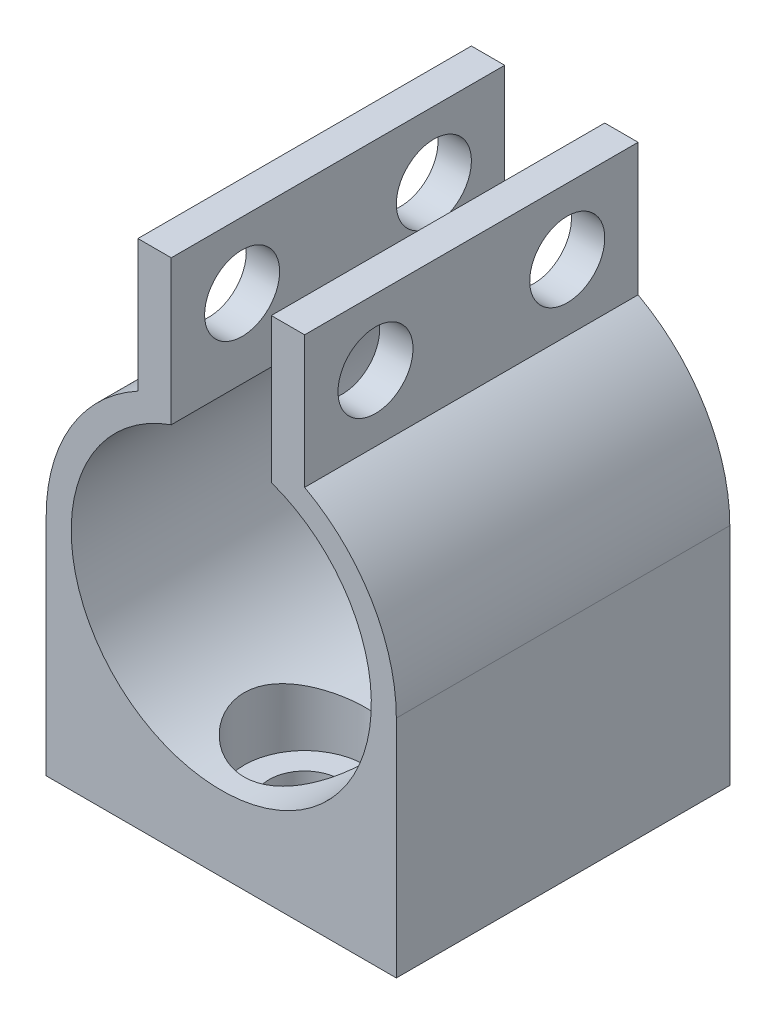
from build123d import *

# Parameters (mm, degrees)
BOSS_EXTRUDE1_DEPTH = 20
SKETCH3_R           = 2.25
CUT_EXTRUDE1_DEPTH  = 31.572849127
SKETCH5_R           = 2.125
CUT_EXTRUDE2_DEPTH  = 39.082228477
CUT_EXTRUDE6_START  = -6
SKETCH6_R           = 3.625
CUT_EXTRUDE6_DEPTH  = 4.5


with BuildPart() as part:
    # Sketch1 → Boss-Extrude1 (new body)
    with BuildSketch(Plane.XY):
        with BuildLine():
            Line((-3, 8.485281374), (-3, 17.159519334))
            Line((-3, 17.159519334), (-5, 17.159519334))
            Line((-5, 17.159519334), (-5, 9.233092656))
            ThreePointArc((-5, 9.233092656), (-9.020809276, 5.373546315), (-10.5, 0))
            Line((-10.5, 0), (-10.5, -13.5))
            Line((-10.5, -13.5), (10.5, -13.5))
            Line((10.5, -13.5), (10.5, 0))
            ThreePointArc((10.5, 0), (9.020809276, 5.373546315), (5, 9.233092656))
            Line((5, 9.233092656), (5, 17.159519334))
            Line((5, 17.159519334), (3, 17.159519334))
            Line((3, 17.159519334), (3, 8.485281374))
            ThreePointArc((3, 8.485281374), (0, -9), (-3, 8.485281374))
        make_face()
    extrude(amount=BOSS_EXTRUDE1_DEPTH)

    # Sketch3 → Cut-Extrude1 (cut, through all)
    with BuildSketch(Plane(origin=(5, 0, 0), x_dir=(0, 0, -1), z_dir=(1, 0, 0))):
        with Locations((-15.75, 13.196305995)):
            Circle(SKETCH3_R)
        with Locations((-4.25, 13.196305995)):
            Circle(SKETCH3_R)
    extrude(amount=-CUT_EXTRUDE1_DEPTH, mode=Mode.SUBTRACT)

    # Sketch5 → Cut-Extrude2 (cut, through all)
    with BuildSketch(Plane.XZ.offset(13.5)):
        with Locations((0, 5)):
            Circle(SKETCH5_R)
        with Locations((0, 15)):
            Circle(SKETCH5_R)
    extrude(amount=-CUT_EXTRUDE2_DEPTH, mode=Mode.SUBTRACT)

    # Sketch6 → Cut-Extrude6 (cut)
    with BuildSketch(Plane.XZ.offset(13.5).offset(CUT_EXTRUDE6_START)):
        with Locations((0, 15)):
            Circle(SKETCH6_R)
        with Locations((0, 5)):
            Circle(SKETCH6_R)
    extrude(amount=CUT_EXTRUDE6_DEPTH, mode=Mode.SUBTRACT)


solid = part.part
